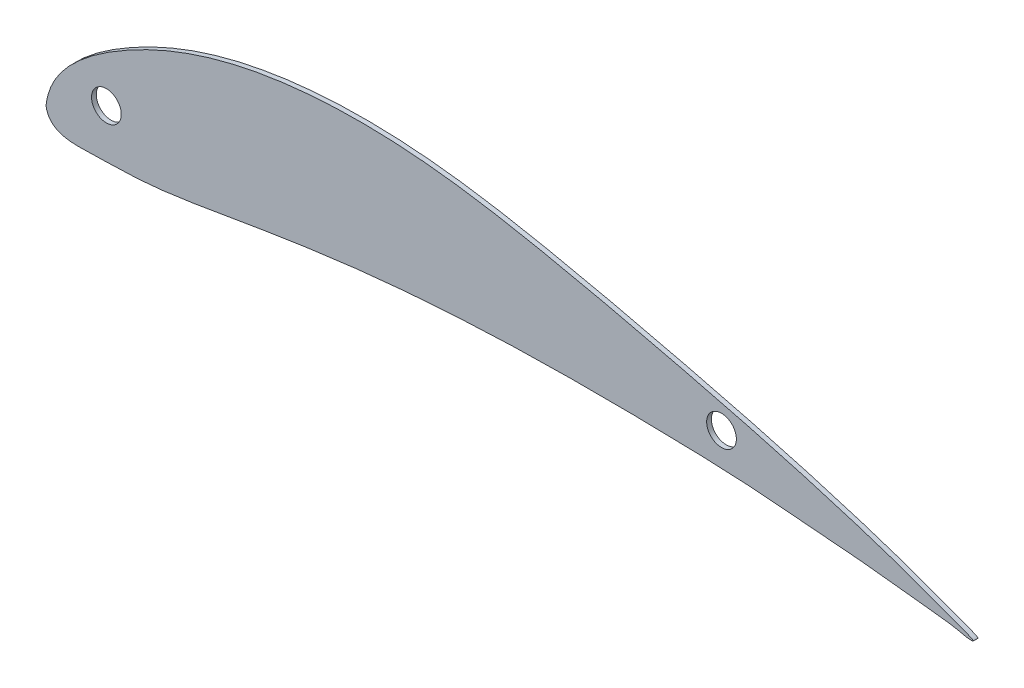
from build123d import *

# Parameters (mm, degrees)
BOSS_EXTRUDE1_DEPTH = 1.5875
SKETCH2_R           = 5
CUT_EXTRUDE1_DEPTH  = 316.731983488


with BuildPart() as part:
    # Sketch1 → Boss-Extrude1 (new body)
    with BuildSketch(Plane.XY):
        with BuildLine():
            add(Edge.make_bspline(
                [(0.000560351, 0.000130087), (0.810633127, 7.359196055), (8.649092025, 17.856605174), (26.286719818, 29.975176328), (52.111128271, 42.069215275), (89.597618475, 49.290763054), (131.400792109, 47.884831915), (173.256699242, 40.041104278), (217.961060472, 29.612974894), (256.952064401, 19.528920948), (290.35983767, 8.71099439), (301.273197721, 4.382828139), (314.816918223, -0.516206742), (309.846313895, 0.000130087)],
                knots=[0, 0, 0, 0, 0.060863618, 0.113688265, 0.188608742, 0.312908923, 0.448482434, 0.557612135, 0.691544113, 0.852438279, 0.92975597, 0.976058229, 1, 1, 1, 1], degree=3))
            add(Edge.make_bspline(
                [(309.846313895, 0.000130087), (303.956832565, 1.47095521), (293.989507544, 2.093987313), (276.26402299, 4.514356704), (260.846344817, 5.427413394), (235.858814759, 7.870306192), (205.101424636, 8.838080282), (157.718638092, 9.030650149), (110.497331172, 6.181495223), (66.506197185, -0.586669107), (36.454672816, -6.098499901), (15.316603331, -6.189065841), (1.230714189, -6.924076091), (0.000560351, 0.000130087)],
                knots=[0, 0, 0, 0, 0.057787081, 0.095274891, 0.171021118, 0.205339302, 0.335319146, 0.464904334, 0.658702312, 0.785511947, 0.893517288, 0.94309214, 1, 1, 1, 1], degree=3))
        make_face()
    extrude(amount=BOSS_EXTRUDE1_DEPTH)

    # Sketch2 → Cut-Extrude1 (cut, through all)
    with BuildSketch(Plane.XY.offset(1.5875)):
        with Locations((20.32, 10.16)):
            Circle(SKETCH2_R)
        with Locations((227.296313895, 19.050130087)):
            Circle(SKETCH2_R)
    extrude(amount=-CUT_EXTRUDE1_DEPTH, mode=Mode.SUBTRACT)


solid = part.part
